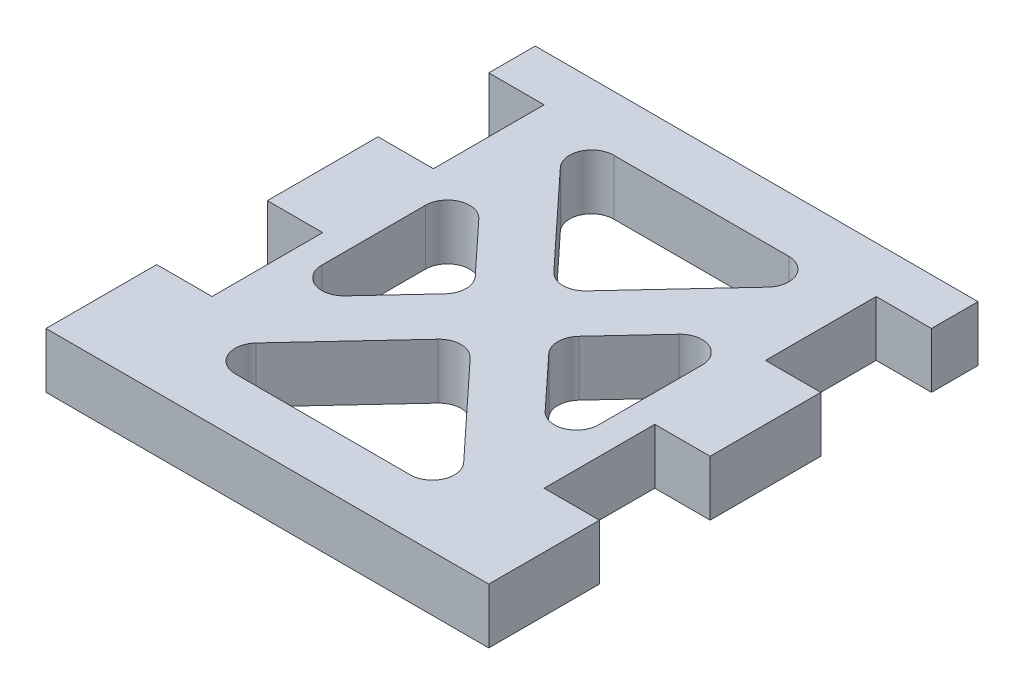
from build123d import *

# Parameters (mm, degrees)
SKETCH1_W            = 50.8
SKETCH1_H            = 56.134
MAIN_DEPTH           = 6.35
SKETCH2_W            = 6.35
SKETCH2_H            = 12.7
ACRYLIC_MOUNTS_DEPTH = 39.382795482
CUT_EXTRUDE2_DEPTH   = 39.382795482
FILLET1_R            = 2.54


with BuildPart() as part:
    # Sketch1 → Main (new body)
    with BuildSketch(Plane(origin=(0, 0, 0), x_dir=(1, 0, 0), z_dir=(0, 1, 0))):
        Rectangle(SKETCH1_W, SKETCH1_H)
    extrude(amount=MAIN_DEPTH)

    # Sketch2 → Acrylic Mounts (cut, through all)
    with BuildSketch(Plane(origin=(0, 6.35, 0), x_dir=(1, 0, 0), z_dir=(0, 1, 0))):
        with Locations((-22.225, -9.017)):
            Rectangle(SKETCH2_W, SKETCH2_H)
        with Locations((-22.225, 16.383)):
            Rectangle(SKETCH2_W, SKETCH2_H)
        with Locations((22.225, 16.383)):
            Rectangle(SKETCH2_W, SKETCH2_H)
        with Locations((22.225, -9.017)):
            Rectangle(SKETCH2_W, SKETCH2_H)
    extrude(amount=-ACRYLIC_MOUNTS_DEPTH, mode=Mode.SUBTRACT)

    # Sketch3 → Cut-Extrude2 (cut, through all)
    with BuildSketch(Plane(origin=(0, 6.35, 0), x_dir=(1, 0, 0), z_dir=(0, 1, 0))):
        Polygon((-15.875, 21.717), (0, 4.660250352), (15.875, 21.717), align=None)
        Polygon((-15.875, 12.396499296), (-4.337372352, 0), (-15.875, -12.396499296), align=None)
        Polygon((-15.875, -21.717), (0, -4.660250352), (15.875, -21.717), align=None)
        Polygon((15.875, -12.396499296), (4.337372352, 0), (15.875, 12.396499296), align=None)
    extrude(amount=-CUT_EXTRUDE2_DEPTH, mode=Mode.SUBTRACT)

    # Fillet1
    fillet1_edges = [part.edges().sort_by_distance(p)[0] for p in [
        (15.875, 3.175, 21.717),
        (15.875, 3.175, 12.396499296),
        (-15.875, 3.175, 21.717),
        (-15.875, 3.175, 12.396499296),
        (0, 3.175, -4.660250352),
        (-15.875, 3.175, -12.396499296),
        (0, 3.175, 4.660250352),
        (-4.337372352, 3.175, 0),
        (15.875, 3.175, -12.396499296),
        (15.875, 3.175, -21.717),
        (4.337372352, 3.175, 0),
        (-15.875, 3.175, -21.717),
    ]]
    fillet(fillet1_edges, radius=FILLET1_R)


solid = part.part
